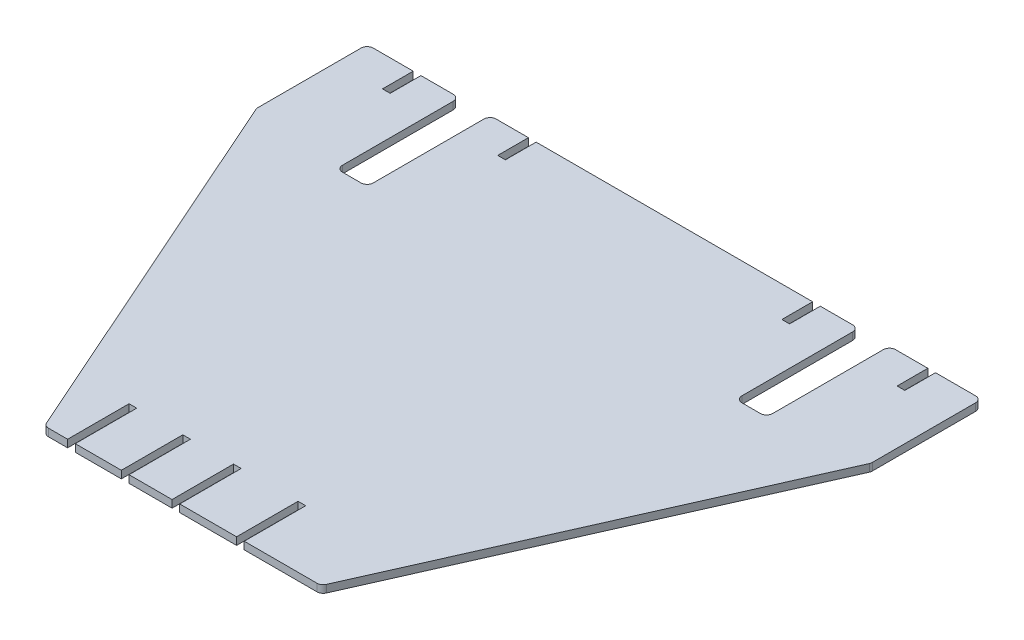
from build123d import *

# Parameters (mm, degrees)
BOSS_EXTRUDE1_DEPTH = 3.0988
FILLET1_R           = 2.54


with BuildPart() as part:
    # Sketch1 → Boss-Extrude1 (new body)
    with BuildSketch(Plane(origin=(0, 0, 0), x_dir=(1, 0, 0), z_dir=(0, 1, 0))):
        Polygon((3.351183213, -101.6), (-1.27, -101.6), (-1.27, -76.2), (-4.445, -76.2), (-4.445, -101.6), (-22.225, -101.6), (-22.225, -76.2), (-25.4, -76.2), (-25.4, -101.6), (-44.45, -101.6), (-44.45, -76.2), (-47.625, -76.2), (-47.625, -101.6), (-57.15, -101.6), (-127, 55.88), (-127, 101.6), (-107.95, 101.6), (-107.95, 88.9), (-104.775, 88.9), (-104.775, 101.6), (-88.9, 101.6), (-88.9, 50.8), (-76.2, 50.8), (-76.2, 101.6), (-60.325, 101.6), (-60.325, 88.9), (-57.15, 88.9), (-57.15, 101.6), (57.15, 101.6), (57.15, 88.9), (60.325, 88.9), (60.325, 101.6), (76.2, 101.6), (76.2, 50.8), (88.9, 50.8), (88.9, 101.6), (104.775, 101.6), (104.775, 88.9), (107.95, 88.9), (107.95, 101.6), (127, 101.6), (127, 55.88), (57.15, -101.6), (25.4, -101.6), (25.4, -76.2), (22.225, -76.2), (22.225, -101.6), align=None)
    extrude(amount=BOSS_EXTRUDE1_DEPTH)

    # Fillet1
    fillet1_edges = [part.edges().sort_by_distance(p)[0] for p in [
        (88.9, 1.5494, -50.8),
        (88.9, 1.5494, -101.6),
        (-127, 1.5494, -55.88),
        (-127, 1.5494, -101.6),
        (-88.9, 1.5494, -101.6),
        (-88.9, 1.5494, -50.8),
        (-76.2, 1.5494, -50.8),
        (-76.2, 1.5494, -101.6),
        (76.2, 1.5494, -101.6),
        (76.2, 1.5494, -50.8),
        (127, 1.5494, -101.6),
        (127, 1.5494, -55.88),
        (57.15, 1.5494, 101.6),
        (-57.15, 1.5494, 101.6),
    ]]
    fillet(fillet1_edges, radius=FILLET1_R)


solid = part.part
